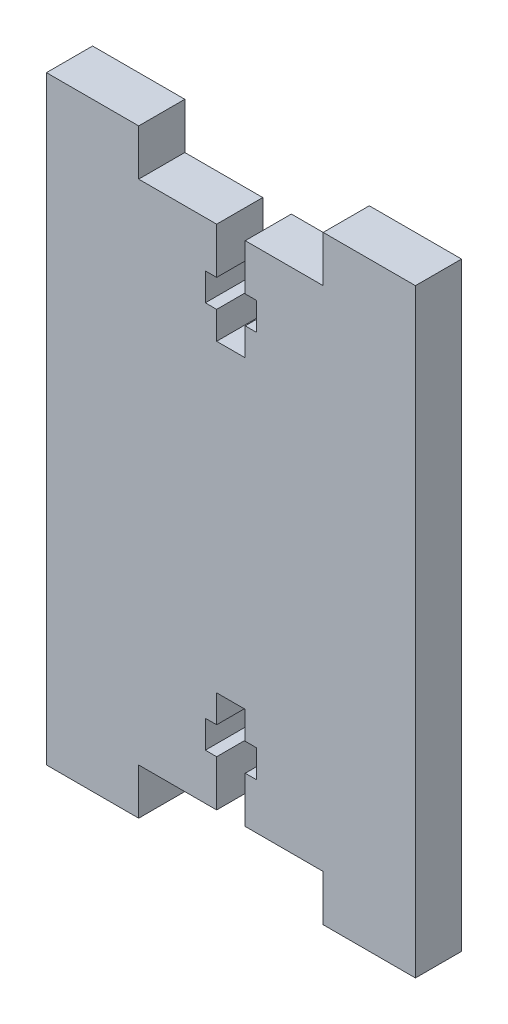
from build123d import *

# Parameters (mm, degrees)
ESQUISSE1_W             = 40
ESQUISSE1_H             = 62
BOSS_EXTRU_1_DEPTH      = 5
ESQUISSE2_W             = 20
ESQUISSE2_H             = 3.5
ENL_V_MAT_EXTRU_1_DEPTH = 38.229020938
ESQUISSE3_W             = 20
ESQUISSE3_H             = 3.5
ENL_V_MAT_EXTRU_2_DEPTH = 38.229020938
ENL_V_MAT_EXTRU_3_DEPTH = 38.229020938
ESQUISSE9_W             = 10
ESQUISSE9_H             = 65
BOSS_EXTRU_2_DEPTH      = 5


with BuildPart() as part:
    # Esquisse1 → Boss.-Extru.1 (new body)
    with BuildSketch(Plane.XY.offset(5)):
        Rectangle(ESQUISSE1_W, ESQUISSE1_H)
    extrude(amount=-BOSS_EXTRU_1_DEPTH)

    # Esquisse2 → Enlèv. mat.-Extru.1 (cut, through all)
    with BuildSketch(Plane(origin=(0, 0, 0), x_dir=(-1, 0, 0), z_dir=(0, 0, -1))):
        with Locations((0, 29.25)):
            Rectangle(ESQUISSE2_W, ESQUISSE2_H)
    extrude(amount=-ENL_V_MAT_EXTRU_1_DEPTH, mode=Mode.SUBTRACT)

    # Esquisse3 → Enlèv. mat.-Extru.2 (cut, through all)
    with BuildSketch(Plane(origin=(0, 0, 0), x_dir=(-1, 0, 0), z_dir=(0, 0, -1))):
        with Locations((0, -29.25)):
            Rectangle(ESQUISSE3_W, ESQUISSE3_H)
    extrude(amount=-ENL_V_MAT_EXTRU_2_DEPTH, mode=Mode.SUBTRACT)

    # Esquisse8 → Enlèv. mat.-Extru.3 (cut, through all)
    with BuildSketch(Plane.XY.offset(5)):
        Polygon((-1.55, -22.5), (-1.55, -27.5), (1.55, -27.5), (1.55, -22.5), (2.775, -22.5), (2.775, -19.5), (1.55, -19.5), (1.55, -16.5), (-1.55, -16.5), (-1.55, -19.5), (-2.775, -19.5), (-2.775, -22.5), align=None)
        Polygon((1.55, 19.5), (2.775, 19.5), (2.775, 22.5), (1.55, 22.5), (1.55, 27.5), (-1.55, 27.5), (-1.55, 22.5), (-2.775, 22.5), (-2.775, 19.5), (-1.55, 19.5), (-1.55, 16.5), (1.55, 16.5), align=None)
    extrude(amount=-ENL_V_MAT_EXTRU_3_DEPTH, mode=Mode.SUBTRACT)

    # Esquisse9 → Boss.-Extru.2 (add)
    with BuildSketch(Plane.XY.offset(5)):
        with Locations((-15, 0)):
            Rectangle(ESQUISSE9_W, ESQUISSE9_H)
        with Locations((15, 0)):
            Rectangle(ESQUISSE9_W, ESQUISSE9_H)
    extrude(amount=-BOSS_EXTRU_2_DEPTH)


solid = part.part
